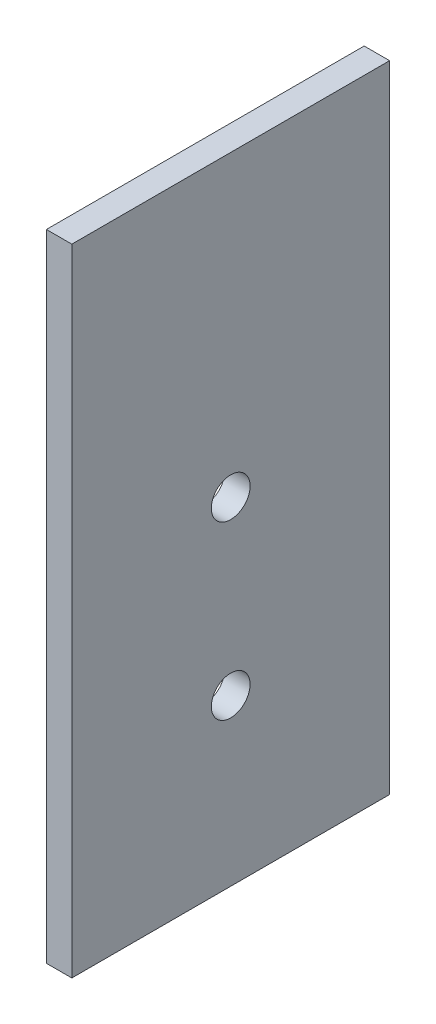
from build123d import *

# Parameters (mm, degrees)
SKETCH1_W           = 25
SKETCH1_H           = 50
BOSS_EXTRUDE1_DEPTH = 2
SKETCH3_R           = 1.525
CUT_EXTRUDE1_DEPTH  = 42.531927578


with BuildPart() as part:
    # Sketch1 → Boss-Extrude1 (new body)
    with BuildSketch(Plane(origin=(0, 0, 0), x_dir=(0, 0, -1), z_dir=(1, 0, 0))):
        with Locations((-12.5, 8.104395604)):
            Rectangle(SKETCH1_W, SKETCH1_H)
    extrude(amount=BOSS_EXTRUDE1_DEPTH)

    # Sketch3 → Cut-Extrude1 (cut, through all)
    with BuildSketch(Plane.ZY):
        with Locations((12.5, -3.895604396)):
            Circle(SKETCH3_R)
        with Locations((12.5, 9.614395604)):
            Circle(SKETCH3_R)
    extrude(amount=-CUT_EXTRUDE1_DEPTH, mode=Mode.SUBTRACT)


solid = part.part
